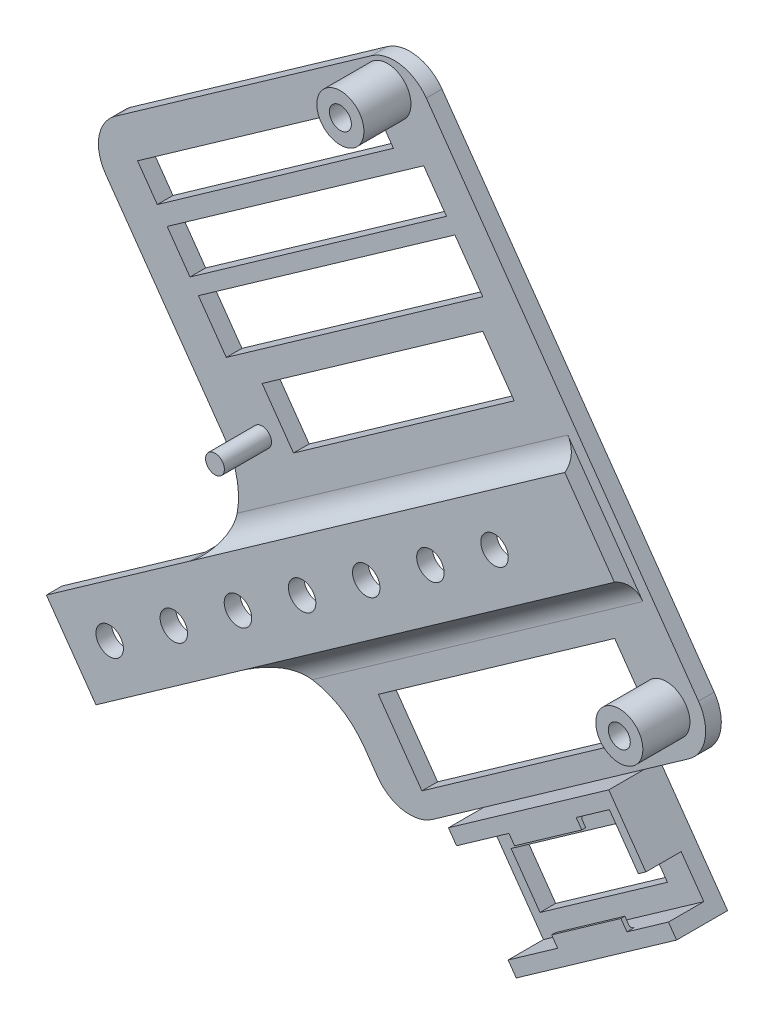
from build123d import *

# Parameters (mm, degrees)
SKETCH_1_R                = 2.1
EXTRUDE_1_DEPTH           = 2
EXTRUDE_2_DEPTH           = 40
EXTRUDE_3_DEPTH           = 2
FILLET_1_R                = 10
EXTRUDE_START             = -4
SKETCH_10_R               = 2.075
EXTRUDE_4_DEPTH           = 4
SKETCH_14_R               = 3.5715559825460215
CUT_EXTRUDE_6_DEPTH       = 4
EXTRUDE_5_DEPTH           = 2
FILLET_START              = 47.050234375
FILLET_4_DEPTH            = 51.949765625
FILLET_START_2            = 39.671388204
FILLET_4_2_DEPTH          = 59.328611796
FILLET_START_3            = 2
FILLET_4_3_DEPTH          = 3
EXTRUDE_START_2           = 2
SKETCH_19_R               = 2.075
EXTRUDE_6_DEPTH           = 2
CUT_EXTRUDE_START         = -2
SKETCH_22_R               = 3.5715559825460206
CUT_EXTRUDE_11_DEPTH      = 2
SKETCH_23_R               = 3.75
CUT_EXTRUDE_12_DEPTH      = 2
CUT_EXTRUDE_13_DEPTH      = 28.999999999999996
CUT_EXTRUDE_14_DEPTH      = 12.999999999999984
SKETCH_29_R               = 3.0000000000000084
SKETCH_29_R_2             = 3.0000000000000018
SKETCH_29_R_3             = 1.2000000000000004
EXTRUDE_8_DEPTH           = 5.999999999999993
CUT_EXTRUDE_15_DEPTH      = 13
M3X0_5_1_D                = 2.8
FILLET_START_4            = -1
FILLET_8_DEPTH            = 4
EXTRUDE_9_DEPTH           = 1.9999999999999991
EXTRUDE_10_DEPTH          = 4.5
EXTRUDE_11_DEPTH          = 0.5
FILLET_9_R                = 0.5
CUT_EXTRUDE_16_DEPTH      = 9.500000000000002
EXTRUDE_12_DEPTH          = 2
CUT_EXTRUDE_19_DEPTH      = 10
CUT_EXTRUDE_19_DEPTH_BACK = 11.999999999999996
SKETCH_44_W               = 6
SKETCH_44_H               = 13.386484239674381
SKETCH_47_W               = 2
SKETCH_47_H               = 10.963872604458905
CUT_EXTRUDE_20_DEPTH      = 73.00000000000006
SKETCH_48_R               = 1.7500000000000004
SKETCH_48_R_2             = 1.7500000000000038
SKETCH_48_R_3             = 1.7499999999999882
SKETCH_48_R_4             = 1.749999999999997
CUT_EXTRUDE_21_DEPTH      = 73.00000000000006


with BuildPart() as part:
    # 草图1 → 凸台-拉伸1 (new body)
    with BuildSketch(Plane.XY):
        with BuildLine():
            Line((5.715095935783956, 0), (15.341111112939824, 6.784600591097247))
            Line((15.341111112939824, 6.784600591097247), (42.49706355926069, 25.92463804463833))
            Line((42.49706355926069, 25.92463804463833), (52.86691877711603, 11.211850995247643))
            Line((52.86691877711603, 11.211850995247643), (93.73577169209018, 40.017004378179195))
            Line((93.73577169209018, 40.017004378179195), (42.483411773869754, 112.7340328625418))
            Line((42.483411773869754, 112.7340328625418), (1.6145588588956372, 83.92887947961026))
            Line((1.6145588588956372, 83.92887947961026), (36.18074291841349, 34.88625598164134))
            Line((36.18074291841349, 34.88625598164134), (-1.7283092029758853, 8.167227110682408))
            Line((-1.7283092029758853, 8.167227110682408), (0, 5.715095935783956))
            ThreePointArc((0, 5.715095935783956), (-4.0411830913245135, -4.041183091324513), (5.715095935783956, 0))
        make_face()
        Circle(SKETCH_1_R, mode=Mode.SUBTRACT)
        with BuildLine():
            Line((7.071067811864017, 9.899494936610912), (6.585786437625429, 9.414213562372302))
            ThreePointArc((6.585786437625429, 9.414213562372302), (6.585786437625458, 6.585786437626118), (9.41421356237164, 6.58578643762615))
            Line((9.41421356237164, 6.58578643762615), (9.899494936610207, 7.071067811864724))
            ThreePointArc((9.899494936610207, 7.071067811864724), (9.899494936610207, 9.899494936610912), (7.071067811864017, 9.899494936610912))
        make_face(mode=Mode.SUBTRACT)
    extrude(amount=EXTRUDE_1_DEPTH)

    # 草图2 → 凸台-拉伸2 (add)
    with BuildSketch(Plane.XY.offset(2)):
        Polygon((2.4787134603835828, 82.70281389216105), (42.12150078790845, 110.64381267360466), (91.64555150315304, 40.37891536414052), (52.00276417562808, 12.43791658269687), (52.86691877711603, 11.211850995247648), (93.73577169209018, 40.017004378179195), (42.483411773869754, 112.7340328625418), (1.6145588588956372, 83.92887947961026), align=None)
    extrude(amount=EXTRUDE_2_DEPTH)

    # 草图4 → 凸台-拉伸3 (add)
    with BuildSketch(Plane.XY.offset(42)):
        Polygon((93.73577169209018, 40.017004378179195), (52.86691877711603, 11.211850995247648), (1.6145588588956372, 83.92887947961026), (42.483411773869754, 112.7340328625418), align=None)
    extrude(amount=EXTRUDE_3_DEPTH)

    # 圆角1
    fillet_1_edges = [part.edges().sort_by_distance(p)[0] for p in [
        (36.18074291841349, 34.88625598164134, 1),
        (42.49706355926069, 25.92463804463833, 1),
    ]]
    fillet(fillet_1_edges, radius=FILLET_1_R)

    # 草图10 → 凸台-拉伸4 (add)
    with BuildSketch(Plane.XY.offset(2).offset(EXTRUDE_START)):
        with BuildLine():
            Line((8.031882820422537, 15.046398123036559), (14.348203461269724, 6.084780186033628))
            Line((14.348203461269724, 6.084780186033628), (5.715095935783956, 0))
            ThreePointArc((5.715095935783956, 0), (-4.0411830913245135, -4.041183091324513), (0, 5.715095935783956))
            Line((0, 5.715095935783956), (-1.7283092029758853, 8.167227110682408))
            Line((-1.7283092029758853, 8.167227110682408), (8.031882820422537, 15.046398123036559))
        make_face()
        Circle(SKETCH_10_R, mode=Mode.SUBTRACT)
        with BuildLine():
            Line((7.071067811864017, 9.899494936610912), (6.58578643762543, 9.4142135623723))
            ThreePointArc((6.58578643762543, 9.4142135623723), (6.585786437625461, 6.585786437626118), (9.414213562371643, 6.58578643762615))
            Line((9.414213562371643, 6.58578643762615), (9.899494936610205, 7.071067811864723))
            ThreePointArc((9.899494936610205, 7.071067811864723), (9.899494936610207, 9.899494936610912), (7.071067811864017, 9.899494936610912))
        make_face(mode=Mode.SUBTRACT)
    extrude(amount=EXTRUDE_4_DEPTH)

    # 草图14 → 切除-拉伸6 (cut)
    with BuildSketch(Plane(origin=(0, 0, 0), x_dir=(-1, 0, 0), z_dir=(0, 0, -1))):
        with Locations((-7.999999999998536, 7.999999999999225)):
            Circle(SKETCH_14_R)
    extrude(amount=-CUT_EXTRUDE_6_DEPTH, mode=Mode.SUBTRACT)

    # 草图17 → 凸台-拉伸5 (add)
    with BuildSketch(Plane.XY.offset(2)):
        Polygon((9.763733946874806, 16.267040097932394), (16.080054587722028, 7.305422160929461), (83.36591647423481, 54.72979142756991), (77.0495958333876, 63.691409364572834), align=None)
    extrude(amount=EXTRUDE_5_DEPTH)

    # 圆角4: read off the stored shape, not the designer's step
    # 圆角4 outline → 圆角4 (add)
    with BuildSketch(Plane(origin=(0, 0, 0), x_dir=(0.5761030676586296, -0.817377058299483, 0), z_dir=(0.8173770582994829, 0.57610306765863, 0)).offset(FILLET_START)):
        with BuildLine():
            ThreePointArc((3.29248099, -4.000009364), (4.388856563, -2.550513124), (6.120911425, -2))
            Line((6.120911425, -2), (3.292484301, -2))
            Line((3.292484301, -2), (3.29248099, -4.000009364))
        make_face()
    extrude(amount=FILLET_4_DEPTH)

    # Fillet 4 2 outline → Fillet 4 2 (add)
    with BuildSketch(Plane(origin=(0, 0, 0), x_dir=(0.5761030676586296, -0.817377058299483, 0), z_dir=(0.8173770582994829, 0.57610306765863, 0)).offset(FILLET_START_2)):
        with BuildLine():
            Line((-7.671384802, -4.000009905), (-7.671388304, -2))
            Line((-7.671388304, -2), (-10.499815429, -2))
            ThreePointArc((-10.499815429, -2), (-8.767760332, -2.55051329), (-7.671384802, -4.000009905))
        make_face()
        with BuildLine():
            ThreePointArc((3.29248099, -4.000009364), (4.388856563, -2.550513124), (6.120911425, -2))
            Line((6.120911425, -2), (3.292484301, -2))
            Line((3.292484301, -2), (3.29248099, -4.000009364))
        make_face()
    extrude(amount=FILLET_4_2_DEPTH)

    # Fillet 4 3 outline → Fillet 4 3 (cut)
    with BuildSketch(Plane.XY.offset(FILLET_START_3)):
        with BuildLine():
            Line((26.37750671, 31.437116691), (28.006972335, 29.125225305))
            ThreePointArc((28.006972335, 29.125225305), (32.099334124, 35.592931139), (30.419712242, 43.060026565))
            Line((30.419712242, 43.060026565), (25, 50.749533353))
            Line((25, 50.749533353), (25, 33.391528054))
            Line((25, 33.391528054), (26.37750671, 31.437116691))
        make_face()
        with BuildLine():
            Line((35.952758438, 17.851715868), (37.257883388, 16))
            Line((37.257883388, 16), (49.49213929, 16))
            Line((49.49213929, 16), (48.258094236, 17.750867462))
            ThreePointArc((48.258094236, 17.750867462), (41.790388402, 21.84322925), (34.323292976, 20.163607368))
            Line((34.323292976, 20.163607368), (35.952758438, 17.851715868))
        make_face()
    extrude(amount=FILLET_4_3_DEPTH, mode=Mode.SUBTRACT)

    # 草图19 → 凸台-拉伸6 (add)
    with BuildSketch(Plane(origin=(0, 0, -2), x_dir=(-1, 0, 0), z_dir=(0, 0, -1)).offset(EXTRUDE_START_2)):
        with BuildLine():
            Line((1.7283092029758853, 8.167227110682408), (-8.031882820422537, 15.046398123036559))
            Line((-8.031882820422537, 15.046398123036559), (-14.348203461269724, 6.084780186033628))
            Line((-14.348203461269724, 6.084780186033628), (-5.715095935783956, 0))
            ThreePointArc((-5.715095935783956, 0), (4.041183091324512, -4.0411830913245135), (3.5e-16, 5.715095935783956))
            Line((3.5e-16, 5.715095935783956), (1.7283092029758853, 8.167227110682408))
        make_face()
        with Locations(Location((0, 0, 0), (0, 0, 180))):
            Circle(SKETCH_19_R, mode=Mode.SUBTRACT)
        with BuildLine():
            Line((-9.414213562371643, 6.58578643762615), (-9.899494936610205, 7.071067811864723))
            ThreePointArc((-9.899494936610205, 7.071067811864723), (-9.899494936610207, 9.899494936610914), (-7.071067811864017, 9.899494936610912))
            Line((-7.071067811864017, 9.899494936610912), (-6.58578643762543, 9.4142135623723))
            ThreePointArc((-6.58578643762543, 9.4142135623723), (-6.585786437625462, 6.585786437626118), (-9.414213562371643, 6.58578643762615))
        make_face(mode=Mode.SUBTRACT)
    extrude(amount=-EXTRUDE_6_DEPTH)

    # 草图22 → 切除-拉伸11 (cut)
    with BuildSketch(Plane.XY.offset(CUT_EXTRUDE_START)):
        with Locations((7.999999999998536, 7.999999999999225)):
            Circle(SKETCH_22_R)
    extrude(amount=CUT_EXTRUDE_11_DEPTH, mode=Mode.SUBTRACT)

    # 草图23 → 切除-拉伸12 (cut)
    with BuildSketch(Plane.XY.offset(2)):
        Circle(SKETCH_23_R)
    extrude(amount=-CUT_EXTRUDE_12_DEPTH, mode=Mode.SUBTRACT)

    # 草图24 → 切除-拉伸13 (cut)
    with BuildSketch(Plane.XY.offset(44.00000000000001)):
        Polygon((1.6145588588956372, 83.92887947961026), (42.483411773869754, 112.7340328625418), (93.73577169209018, 40.017004378179195), (52.86691877711603, 11.211850995247648), (2.4787134603835828, 82.70281389216105), align=None)
    extrude(amount=-CUT_EXTRUDE_13_DEPTH, mode=Mode.SUBTRACT)

    # 草图25 → 切除-拉伸14 (cut)
    with BuildSketch(Plane.XY.offset(15.000000000000007)):
        Polygon((2.4787134603835828, 82.70281389216105), (1.6145588588956372, 83.92887947961026), (42.48341177386975, 112.7340328625418), (93.73577169209018, 40.017004378179195), (52.86691877711603, 11.211850995247648), (52.00276417562802, 12.437916582696838), (91.64555150315304, 40.37891536414052), (42.12150078790842, 110.64381267360463), align=None)
    extrude(amount=-CUT_EXTRUDE_14_DEPTH, mode=Mode.SUBTRACT)

    # 草图29 → 凸台-拉伸8 (add)
    with BuildSketch(Plane.XY.offset(2)):
        with Locations((86.76837106229962, 41.223374331383454)):
            Circle(SKETCH_29_R)
        with Locations((51.2228117877621, 91.65553882846152)):
            Circle(SKETCH_29_R_2)
        with Locations((35.247091362615166, 45.46860572527032)):
            Circle(SKETCH_29_R_3)
    extrude(amount=EXTRUDE_8_DEPTH)

    # 草图30 → 切除-拉伸15 (cut)
    with BuildSketch(Plane.XY.offset(2)):
        Polygon((1.6145588588956372, 83.92887947961026), (42.48341177386975, 112.7340328625418), (53.29333634245431, 97.39687387080285), (12.424483427480185, 68.59172048787134), align=None)
    extrude(amount=-CUT_EXTRUDE_15_DEPTH, mode=Mode.SUBTRACT)

    # M3x0.5 螺纹孔1 (through all)
    with Locations(Plane.XY.offset(7.999999999999993)):
        with Locations((51.222811788, 91.655538828), (86.768371062, 41.223374331)):
            Hole(M3X0_5_1_D / 2)

    # 圆角8: read off the stored shape, not the designer's step
    # 圆角8 outline → 圆角8 (cut)
    with BuildSketch(Plane.XY.offset(FILLET_START_4)):
        with BuildLine():
            Line((52.866918777, 11.211850995), (56.953804069, 14.092366334))
            ThreePointArc((56.953804069, 14.092366334), (53.220256356, 13.252555392), (49.986403439, 15.298736287))
            Line((49.986403439, 15.298736287), (52.866918777, 11.211850995))
        make_face()
        with BuildLine():
            ThreePointArc((15.304998766, 64.504835196), (14.465187825, 68.238382909), (16.511368719, 71.472235826))
            Line((16.511368719, 71.472235826), (12.424483427, 68.591720488))
            Line((12.424483427, 68.591720488), (15.304998766, 64.504835196))
        make_face()
        with BuildLine():
            ThreePointArc((49.206451051, 94.516358533), (52.939998764, 95.356169474), (56.173851681, 93.309988579))
            Line((56.173851681, 93.309988579), (53.293336342, 97.396873871))
            Line((53.293336342, 97.396873871), (49.206451051, 94.516358533))
        make_face()
        with BuildLine():
            ThreePointArc((90.855256354, 44.10388967), (91.695067295, 40.370341957), (89.648886401, 37.13648904))
            Line((89.648886401, 37.13648904), (93.735771692, 40.017004378))
            Line((93.735771692, 40.017004378), (90.855256354, 44.10388967))
        make_face()
    extrude(amount=FILLET_8_DEPTH, mode=Mode.SUBTRACT)

    # 草图35 → 凸台-拉伸9 (add)
    with BuildSketch(Plane.XY.offset(2)):
        Polygon((83.9272469924964, 33.10376756627563), (63.492820535009336, 18.701190874809864), (72.1343665498888, 6.440535000317625), (92.56879300737585, 20.843111691783392), align=None)
    extrude(amount=-EXTRUDE_9_DEPTH)

    # 草图36 → 凸台-拉伸10 (add)
    with BuildSketch(Plane.XY.offset(2)):
        Polygon((83.9272469924964, 33.10376756627563), (88.65129214729717, 26.401275688219865), (87.69528224340063, 25.727461525276922), (84.0082226103854, 30.95867469839361), (64.52980605679488, 17.2299121698708), (63.49282053500935, 18.70119087480987), align=None)
        Polygon((72.1343665498888, 6.440535000317625), (92.56879300737585, 20.843111691783392), (91.5318074855903, 22.31439039672246), (71.09738102810324, 7.911813705256714), align=None)
    extrude(amount=EXTRUDE_10_DEPTH)

    # 草图38 → 凸台-拉伸11 (add)
    with BuildSketch(Plane.XY.offset(6.5)):
        Polygon((71.20701372358899, 21.936136526395817), (79.77043226489411, 27.97179857636138), (80.48699168922953, 26.955141545284572), (71.92357314792442, 20.919479495319017), align=None)
        Polygon((86.2422183193346, 18.586186241257604), (77.41533643660377, 12.36483016223927), (76.64618005583336, 13.456111940066782), (85.47306193856419, 19.677468019085115), align=None)
    extrude(amount=-EXTRUDE_11_DEPTH)

    # 圆角9
    fillet_9_edges = [part.edges().sort_by_distance(p)[0] for p in [
        (75.48872299424156, 24.953967551378597, 6),
        (81.82877737796917, 15.475508201748436, 6),
    ]]
    fillet(fillet_9_edges, radius=FILLET_9_R)

    # 草图40 → 切除-拉伸16 (cut)
    with BuildSketch(Plane.XY.offset(2)):
        Polygon((65.96583570106971, 15.192468260678279), (69.64530996532923, 9.972017235426623), (86.89967078383748, 22.133222516514135), (83.22019651957794, 27.353673541765804), align=None)
        Polygon((79.13062239501116, 33.15597569096527), (85.72890544742685, 37.806572461671124), (80.1765478028438, 45.68427701304691), (50.06316674834756, 24.459787009423422), (55.61552439293061, 16.582082458047644), align=None)
        Polygon((39.25145299063004, 45.68427701304691), (67.37307339397086, 65.5049358110826), (63.37371277016225, 71.17924272816451), (35.25209236682142, 51.35858393012882), align=None)
        Polygon((30.685761748669528, 51.952517364922464), (63.37371277016222, 74.99161378651206), (59.82181706782164, 80.03105589947442), (27.133866046328958, 56.99195947788482), align=None)
        Polygon((26.06105069463626, 58.51407367149419), (23.152992111790248, 62.64003741522087), (55.84094313328293, 85.6791338368105), (58.74900171612895, 81.55317009308379), align=None)
        Polygon((21.894829409934886, 64.42512308102752), (19.378576670767988, 67.99519131593051), (49.49195772526422, 89.2196813195541), (51.98740367066816, 85.6791338368105), align=None)
    extrude(amount=-CUT_EXTRUDE_16_DEPTH, mode=Mode.SUBTRACT)

    # 草图41 → 凸台-拉伸12 (add)
    with BuildSketch(Plane.XY.offset(2)):
        Polygon((69.64530996532923, 9.972017235426623), (65.96583570106971, 15.192468260678279), (66.98240526122602, 15.908966033827006), (70.66187952548556, 10.688515008575354), align=None)
    extrude(amount=-EXTRUDE_12_DEPTH)

    # 草图44 → 切除-拉伸19 (cut, two sides: drawn at the far end of the back side and taken through both)
    with BuildSketch(Plane(origin=(2.6912011320959124, 1.896810305775386, 0), x_dir=(0, 0, 1), z_dir=(-0.8173770582994837, -0.5761030676586286, 0)).offset(-CUT_EXTRUDE_19_DEPTH_BACK)):
        with Locations((-1, 0.9781461840532351)):
            Rectangle(SKETCH_44_W, SKETCH_44_H)
    extrude(amount=CUT_EXTRUDE_19_DEPTH + CUT_EXTRUDE_19_DEPTH_BACK, mode=Mode.SUBTRACT)

    # 草图47 → 切除-拉伸20 (cut)
    with BuildSketch(Plane(origin=(12.499725831689716, 8.810047117678929, 0), x_dir=(0, 0, 1), z_dir=(-0.8173770582994837, -0.5761030676586286, 0))):
        with Locations((1, 2.1894520016609684)):
            Rectangle(SKETCH_47_W, SKETCH_47_H)
    extrude(amount=-CUT_EXTRUDE_20_DEPTH, mode=Mode.SUBTRACT)

    # 草图48 → 切除-拉伸21 (cut)
    with BuildSketch(Plane.XY.offset(4)):
        with Locations((17.826156617095315, 15.242849535382714)):
            Circle(SKETCH_48_R)
        with Locations((25.99992720009014, 21.00388021196902)):
            Circle(SKETCH_48_R)
        with Locations((34.17369778308496, 26.764910888555324)):
            Circle(SKETCH_48_R_2)
        with Locations((50.52123894907465, 38.28697224172791)):
            Circle(SKETCH_48_R_2)
        with Locations((42.34746836607982, 32.52594156514159)):
            Circle(SKETCH_48_R_2)
        with Locations((58.69500953206948, 44.04800291831422)):
            Circle(SKETCH_48_R_3)
        with Locations((66.8687801150643, 49.80903359490054)):
            Circle(SKETCH_48_R_4)
    extrude(amount=-CUT_EXTRUDE_21_DEPTH, mode=Mode.SUBTRACT)


solid = part.part
